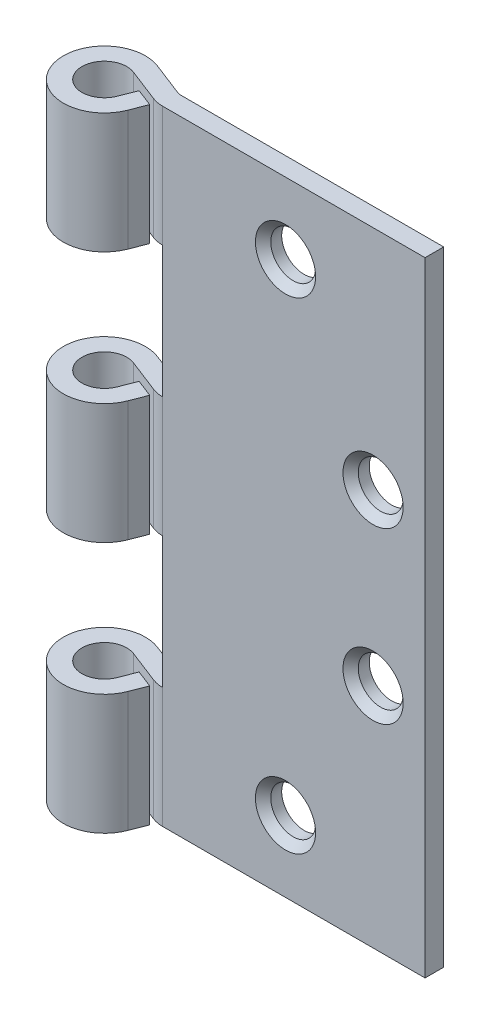
from build123d import *

# Parameters (mm, degrees)
BODYS_W                       = 48
BODYS_H                       = 114
BODY_DEPTH                    = 1.7
MIRROR1_START                 = -1.7
MIRROR1_OUTLINE_R             = 4.1
MIRROR1_DEPTH                 = 3.4
KNUCKLEBODY_REACH             = 63.87
KNUCKLEBODY_DIRECTION_2_REACH = 63.87
HOLECHAMFER_SIZE              = 1.4
KNUCKLECUTS_W                 = 17
KNUCKLECUTS_H                 = 24
KNUCKLECUT_DEPTH              = 71.965414111


# Read off the part's stored shape, not the designer's step: Mirror1
with BuildPart() as part:
    # BodyS → Body (new, symmetric)
    with BuildSketch(Plane.XY):
        Rectangle(BODYS_W, BODYS_H)
    extrude(amount=BODY_DEPTH, both=True)

    # Mirror1 outline → Mirror1 (cut)
    with BuildSketch(Plane.XY.offset(MIRROR1_START)):
        with Locations((14.5, 15.5)):
            Circle(MIRROR1_OUTLINE_R)
        with Locations((-1.5, 44)):
            Circle(MIRROR1_OUTLINE_R)
        with Locations((14.5, -15.5)):
            Circle(MIRROR1_OUTLINE_R)
        with Locations((-1.5, -44)):
            Circle(MIRROR1_OUTLINE_R)
    extrude(amount=MIRROR1_DEPTH, mode=Mode.SUBTRACT)

    # KnuckleBody: up to this face of the body (flat: up to its plane)
    knucklebody_end = Plane(part.part.faces().sort_by_distance((0, 57, 0))[0])
    # KnuckleBodyS → KnuckleBody (add, up to the picked face)
    with BuildSketch(Plane(origin=(0, 0, 0), x_dir=(1, 0, 0), z_dir=(0, 1, 0)), mode=Mode.PRIVATE) as knucklebody_sk1:
        with BuildLine():
            Line((-30.783018868, 4.190566038), (-24.724528302, 1.835849057))
            ThreePointArc((-24.724528302, 1.835849057), (-24.36857707, 1.734255626), (-24, 1.7))
            Line((-24, 1.7), (-24, -1.7))
            ThreePointArc((-24, -1.7), (-24.995158089, -1.607509809), (-25.956226415, -1.333207547))
            Line((-25.956226415, -1.333207547), (-32.014716981, 1.021509434))
            ThreePointArc((-32.014716981, 1.021509434), (-37.25246893, -4.451961541), (-29.678490566, -4.285283019))
            Line((-29.678490566, -4.285283019), (-28.555471698, -1.395849057))
            Line((-28.555471698, -1.395849057), (-25.386415094, -2.62754717))
            Line((-25.386415094, -2.62754717), (-26.509433962, -5.516981132))
            ThreePointArc((-26.509433962, -5.516981132), (-40.364272432, -5.821880867), (-30.783018868, 4.190566038))
        make_face()
    knucklebody_tool1 = split(extrude(knucklebody_sk1.sketch, amount=KNUCKLEBODY_REACH, mode=Mode.PRIVATE), bisect_by=knucklebody_end, keep=Keep.BOTH, mode=Mode.PRIVATE)
    add(knucklebody_tool1.solids().sort_by(Axis((-40.156774, 0, 5.730533), (0, 1, 0)))[0])

    # KnuckleBody direction 2: up to this face of the body (flat: up to its plane)
    knucklebody_direction_2_end = Plane(part.part.faces().sort_by_distance((0, -57, 0))[0])
    # KnuckleBodyS → KnuckleBody direction 2 (add, up to the picked face)
    with BuildSketch(Plane(origin=(0, 0, 0), x_dir=(1, 0, 0), z_dir=(0, 1, 0)), mode=Mode.PRIVATE) as knucklebody_direction_2_sk1:
        with BuildLine():
            Line((-30.783018868, 4.190566038), (-24.724528302, 1.835849057))
            ThreePointArc((-24.724528302, 1.835849057), (-24.36857707, 1.734255626), (-24, 1.7))
            Line((-24, 1.7), (-24, -1.7))
            ThreePointArc((-24, -1.7), (-24.995158089, -1.607509809), (-25.956226415, -1.333207547))
            Line((-25.956226415, -1.333207547), (-32.014716981, 1.021509434))
            ThreePointArc((-32.014716981, 1.021509434), (-37.25246893, -4.451961541), (-29.678490566, -4.285283019))
            Line((-29.678490566, -4.285283019), (-28.555471698, -1.395849057))
            Line((-28.555471698, -1.395849057), (-25.386415094, -2.62754717))
            Line((-25.386415094, -2.62754717), (-26.509433962, -5.516981132))
            ThreePointArc((-26.509433962, -5.516981132), (-40.364272432, -5.821880867), (-30.783018868, 4.190566038))
        make_face()
    knucklebody_direction_2_tool1 = split(extrude(knucklebody_direction_2_sk1.sketch, amount=-KNUCKLEBODY_DIRECTION_2_REACH, mode=Mode.PRIVATE), bisect_by=knucklebody_direction_2_end, keep=Keep.BOTH, mode=Mode.PRIVATE)
    add(knucklebody_direction_2_tool1.solids().sort_by(Axis((-40.156774, 0, 5.730533), (0, -1, 0)))[0])

    # HoleChamfer
    holechamfer_edges = [part.edges().sort_by_distance(p)[0] for p in [
        (10.4, 15.5, 1.7),
        (-5.6, 44, 1.7),
        (10.4, -15.5, 1.7),
        (-5.6, -44, 1.7),
    ]]
    chamfer(holechamfer_edges, length=HOLECHAMFER_SIZE)

    # KnuckleCutS → KnuckleCut (cut, symmetric)
    with BuildSketch(Plane.XY):
        with Locations((-32.5, 23)):
            Rectangle(KNUCKLECUTS_W, KNUCKLECUTS_H)
    knucklecut = extrude(amount=KNUCKLECUT_DEPTH, both=True, mode=Mode.SUBTRACT)

    # KCVM: KnuckleCut across plane
    add(knucklecut.mirror(Plane.ZX), mode=Mode.SUBTRACT)


solid = part.part
